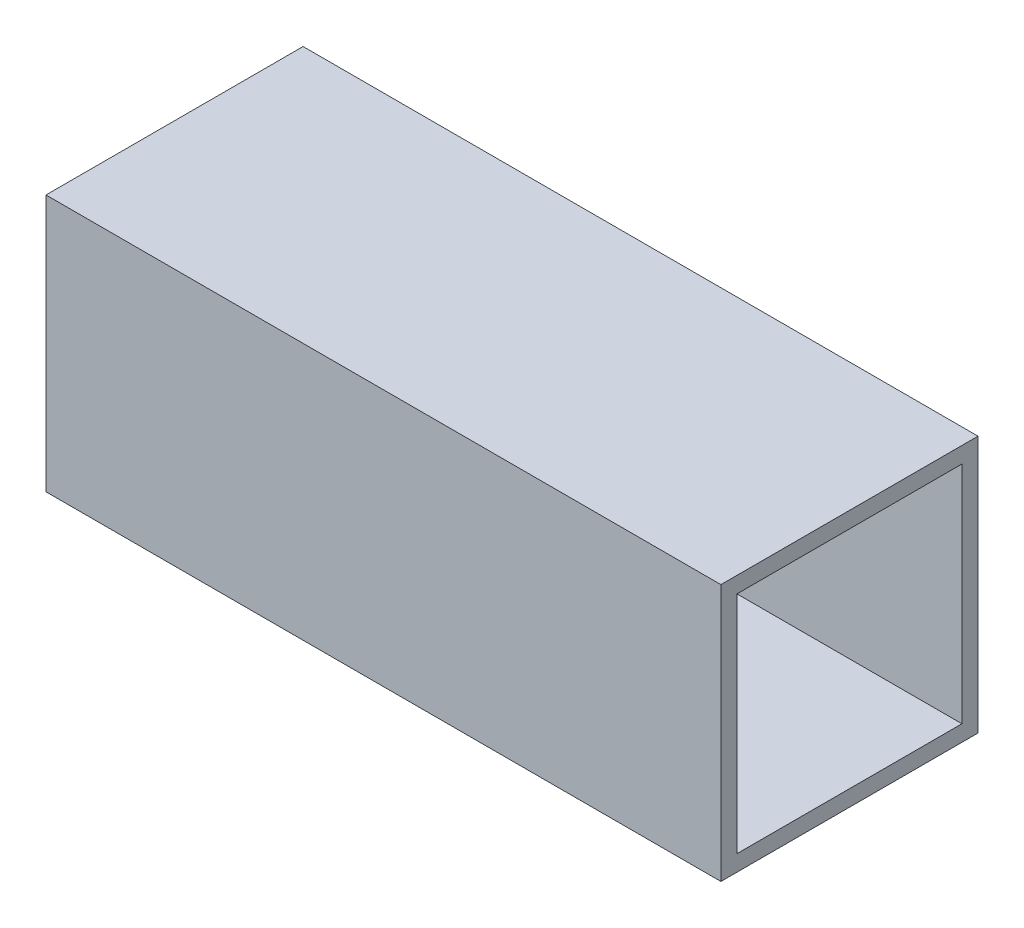
from build123d import *

# Parameters (mm, degrees)
SKETCH1_W           = 50.8
SKETCH1_H           = 50.8
BOSS_EXTRUDE1_DEPTH = 133.35
SHELL1_T            = -3.175


with BuildPart() as part:
    # Sketch1 → Boss-Extrude1 (new body)
    with BuildSketch(Plane(origin=(0, 0, 0), x_dir=(0, 0, -1), z_dir=(1, 0, 0))):
        with Locations((25.4, 25.4)):
            Rectangle(SKETCH1_W, SKETCH1_H)
    extrude(amount=BOSS_EXTRUDE1_DEPTH)

    # Shell1
    shell1_openings = [part.faces().sort_by_distance(p)[0] for p in [
        (0, 25.4, -25.4),
        (133.35, 25.4, -25.4),
    ]]
    offset(amount=SHELL1_T, openings=shell1_openings, kind=Kind.INTERSECTION)


solid = part.part
